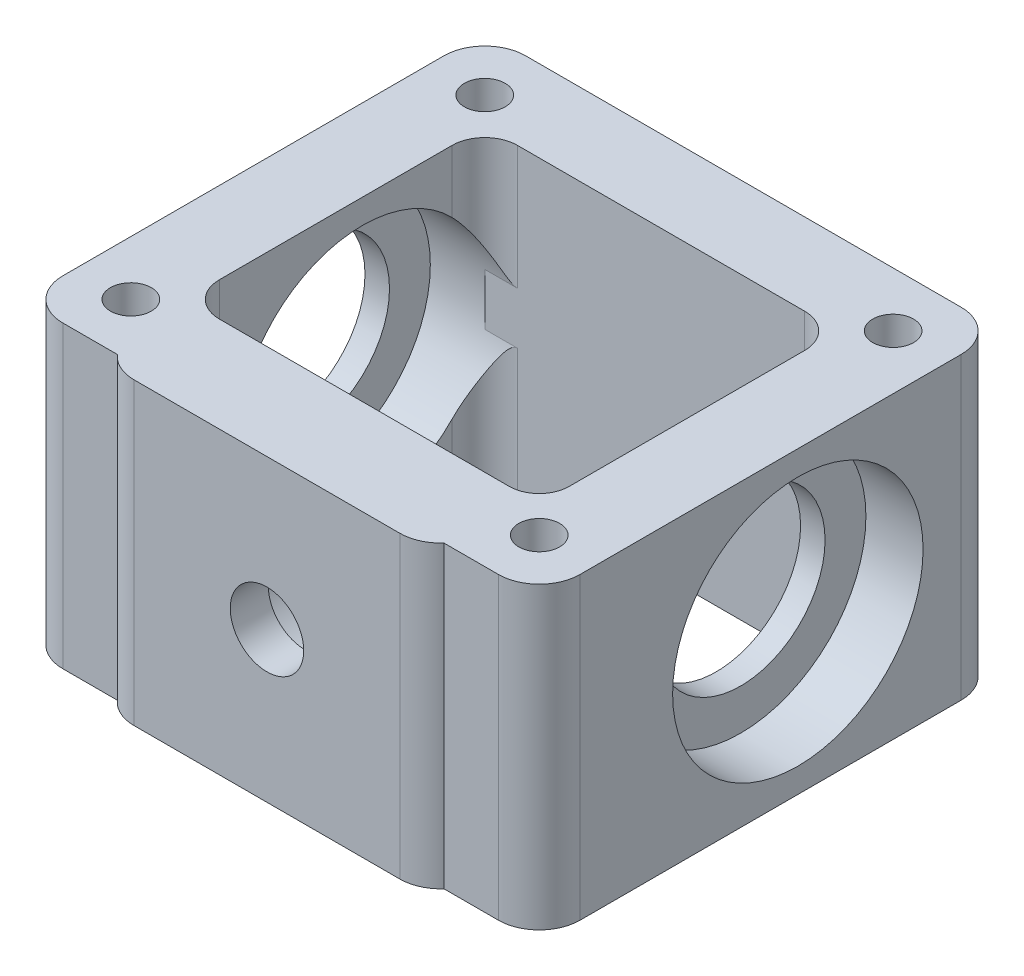
from build123d import *

# Parameters (mm, degrees)
SKETCH3_W           = 38
SKETCH3_H           = 34
SKETCH3_W_2         = 26
SKETCH3_H_2         = 22
BOSS_EXTRUDE1_DEPTH = 22
SKETCH4_W           = 24
SKETCH4_H           = 22
BOSS_EXTRUDE2_DEPTH = 1
SKETCH5_R           = 2.7
CUT_EXTRUDE1_DEPTH  = 12
SKETCH7_R           = 5.7
CUT_EXTRUDE3_DEPTH  = 4.2
SKETCH8_R           = 6.2
CUT_EXTRUDE4_DEPTH  = 57.151580565
SKETCH9_R           = 9.2
CUT_EXTRUDE5_DEPTH  = 4.2
SKETCH10_R          = 9.2
CUT_EXTRUDE6_DEPTH  = 4.2
SKETCH15_R          = 1.5
CUT_EXTRUDE7_DEPTH  = 57.151580565
FILLET1_R           = 3
FILLET3_R           = 2.5
FILLET4_R           = 2.2
FILLET5_R           = 2.4


with BuildPart() as part:
    # Sketch3 → Boss-Extrude1 (new body)
    with BuildSketch(Plane(origin=(0, 0, 0), x_dir=(1, 0, 0), z_dir=(0, 1, 0))):
        with Locations((19, -17)):
            Rectangle(SKETCH3_W, SKETCH3_H)
        with Locations((19, -17)):
            Rectangle(SKETCH3_W_2, SKETCH3_H_2, mode=Mode.SUBTRACT)
    extrude(amount=BOSS_EXTRUDE1_DEPTH)

    # Sketch4 → Boss-Extrude2 (add)
    with BuildSketch(Plane.XY.offset(34)):
        with Locations((19, 11)):
            Rectangle(SKETCH4_W, SKETCH4_H)
    extrude(amount=BOSS_EXTRUDE2_DEPTH)

    # Sketch5 → Cut-Extrude1 (cut)
    with BuildSketch(Plane.XY.offset(35)):
        with Locations((19, 11)):
            Circle(SKETCH5_R)
    extrude(amount=-CUT_EXTRUDE1_DEPTH, mode=Mode.SUBTRACT)

    # Sketch7 → Cut-Extrude3 (cut)
    with BuildSketch(Plane(origin=(0, 0, 28), x_dir=(-1, 0, 0), z_dir=(0, 0, -1))):
        with Locations((-19, 11)):
            Circle(SKETCH7_R)
    extrude(amount=-CUT_EXTRUDE3_DEPTH, mode=Mode.SUBTRACT)

    # Sketch8 → Cut-Extrude4 (cut, through all)
    with BuildSketch(Plane(origin=(38, 0, 0), x_dir=(0, 0, -1), z_dir=(1, 0, 0))):
        with Locations((-15, 11)):
            Circle(SKETCH8_R)
    extrude(amount=-CUT_EXTRUDE4_DEPTH, mode=Mode.SUBTRACT)

    # Sketch9 → Cut-Extrude5 (cut)
    with BuildSketch(Plane(origin=(6, 0, 0), x_dir=(0, 0, -1), z_dir=(1, 0, 0))):
        with Locations((-15, 11)):
            Circle(SKETCH9_R)
    extrude(amount=-CUT_EXTRUDE5_DEPTH, mode=Mode.SUBTRACT)

    # Sketch10 → Cut-Extrude6 (cut)
    with BuildSketch(Plane(origin=(38, 0, 0), x_dir=(0, 0, -1), z_dir=(1, 0, 0))):
        with Locations((-15, 11)):
            Circle(SKETCH10_R)
    extrude(amount=-CUT_EXTRUDE6_DEPTH, mode=Mode.SUBTRACT)

    # Sketch15 → Cut-Extrude7 (cut, through all)
    with BuildSketch(Plane(origin=(0, 0, 0), x_dir=(-1, 0, 0), z_dir=(0, -1, 0))):
        with Locations(Location((-4, -30, 0), (0, 0, 90))):
            Circle(SKETCH15_R)
        with Locations(Location((-34, -30, 0), (0, 0, 90))):
            Circle(SKETCH15_R)
        with Locations(Location((-34, -4, 0), (0, 0, 90))):
            Circle(SKETCH15_R)
        with Locations(Location((-4, -4, 0), (0, 0, 90))):
            Circle(SKETCH15_R)
    extrude(amount=-CUT_EXTRUDE7_DEPTH, mode=Mode.SUBTRACT)

    # Fillet1
    # the kernel refuses this fillet: 3 mm, written as the material it takes off along each edge
    with BuildSketch(Plane(origin=(38, -7.5, 0), x_dir=(-1, 0, 0), z_dir=(0, 1, 0)), Plane(origin=(38, -7.5, 34), x_dir=(0, 0, -1), z_dir=(0, 1, 0))) as fillet1_piece_1:
        with BuildLine():
            CenterArc((FILLET1_R, FILLET1_R), FILLET1_R, 180, 90)
            Line((0, FILLET1_R), (-FILLET1_R * 0.02, FILLET1_R))
            Line((-FILLET1_R * 0.02, FILLET1_R), (-FILLET1_R * 0.02, -FILLET1_R * 0.02))
            Line((-FILLET1_R * 0.02, -FILLET1_R * 0.02), (FILLET1_R, -FILLET1_R * 0.02))
            Line((FILLET1_R, -FILLET1_R * 0.02), (FILLET1_R, 0))
        make_face()
    extrude(amount=37, mode=Mode.SUBTRACT)
    with BuildSketch(Plane(origin=(7, -5.590169944, 35), x_dir=(0, 0, -1), z_dir=(0, 1, 0)), Plane(origin=(31, 27.590169944, 35), x_dir=(0, 0, -1), z_dir=(0, -1, 0))) as fillet1_piece_2:
        with BuildLine():
            CenterArc((3, -2.236067977), FILLET1_R, 131.810314896, 48.189685104)
            Line((0, -2.236067977), (-0.06, -2.236067977))
            Line((-0.06, -2.236067977), (-0.06, 0))
            Line((-0.06, 0), (0, 0.06))
            ThreePointArc((0, 0.06), (0.5, 0.06), (0.96, 0.04472136))
            Line((0.96, 0.04472136), (1, 0))
        make_face()
    extrude(amount=33.180339887, mode=Mode.SUBTRACT)
    with BuildSketch(Plane(origin=(0, -7.5, 34), x_dir=(0, 0, -1), z_dir=(0, 1, 0)), Plane(origin=(0, -7.5, 0), x_dir=(1, 0, 0), z_dir=(0, 1, 0))) as fillet1_piece_3:
        with BuildLine():
            CenterArc((FILLET1_R, -FILLET1_R), FILLET1_R, 90, 90)
            Line((0, -FILLET1_R), (-FILLET1_R * 0.02, -FILLET1_R))
            Line((-FILLET1_R * 0.02, -FILLET1_R), (-FILLET1_R * 0.02, FILLET1_R * 0.02))
            Line((-FILLET1_R * 0.02, FILLET1_R * 0.02), (FILLET1_R, FILLET1_R * 0.02))
            Line((FILLET1_R, FILLET1_R * 0.02), (FILLET1_R, 0))
        make_face()
    extrude(amount=37, mode=Mode.SUBTRACT)

    # Fillet3
    fillet3_edges = [part.edges().sort_by_distance(p)[0] for p in [
        (6, 11, 28),
        (32, 11, 6),
    ]]
    fillet(fillet3_edges, radius=FILLET3_R)

    # Fillet4
    fillet4_edges = [part.edges().sort_by_distance(p)[0] for p in [
        (32, 11, 28),
    ]]
    fillet(fillet4_edges, radius=FILLET4_R)

    # Fillet5
    # the kernel refuses this fillet: 2.4 mm, written as the material it adds along each edge
    with BuildSketch(Plane(origin=(6, 6.907878403, 6), x_dir=(0, 0, 1), z_dir=(0, 1, 0))) as fillet5_piece_1_section:
        with BuildLine():
            CenterArc((FILLET5_R, FILLET5_R), FILLET5_R, 180, 90)
            Line((0, FILLET5_R), (0, 0))
            Line((0, 0), (FILLET5_R, 0))
        make_face()
    fillet5_piece_1 = extrude(amount=15.092121597, mode=Mode.PRIVATE)
    fillet5_piece_1 = fillet5_piece_1 - Plane(origin=(6.778295216, 11, 15), x_dir=(0, 0, -1), z_dir=(1, 0, 0)) * Cylinder(9.2, 40, mode=Mode.PRIVATE)
    add(fillet5_piece_1)
    with BuildSketch(Plane(origin=(6, 0, 6), x_dir=(0, 0, 1), z_dir=(0, 1, 0))) as fillet5_piece_2_section:
        with BuildLine():
            CenterArc((FILLET5_R, FILLET5_R), FILLET5_R, 180, 90)
            Line((0, FILLET5_R), (0, 0))
            Line((0, 0), (FILLET5_R, 0))
        make_face()
    fillet5_piece_2 = extrude(amount=15.092121597, mode=Mode.PRIVATE)
    fillet5_piece_2 = fillet5_piece_2 - Plane(origin=(6.572967992, 11, 15), x_dir=(0, 0, -1), z_dir=(1, 0, 0)) * Cylinder(9.2, 40, mode=Mode.PRIVATE)
    add(fillet5_piece_2)


solid = part.part
